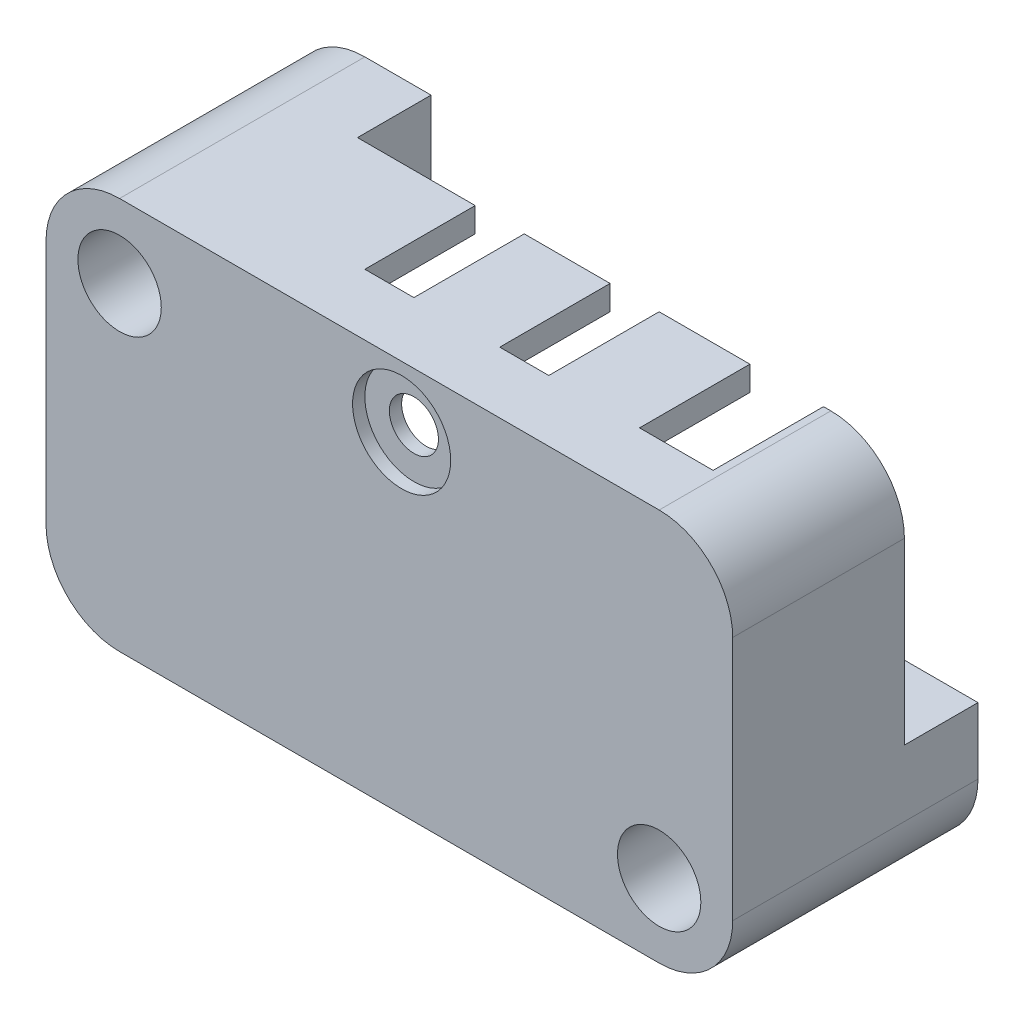
from build123d import *

# Parameters (mm, degrees)
SZKIC1_W                        = 28
SZKIC1_H                        = 16
DODANIE_WYCI_GNI_CIE1_DEPTH     = 10
WYTNIJ_WYCI_GNI_CIE1_REACH      = 20.974
SZKIC2_R                        = 1.7
ZAOKR_GLENIE1_R                 = 3
WYTNIJ_WYCI_GNI_CIE2_DEPTH      = 4
WYTNIJ_WYCI_GNI_CIE2_DEPTH_BACK = 4
WYTNIJ_WYCI_GNI_CIE3_DEPTH      = 3
WYTNIJ_WYCI_GNI_CIE4_REACH      = 25.495
SZKIC5_W                        = 2
SZKIC5_H                        = 4.5
SZKIC5_W_2                      = 3
SZKIC6_R                        = 2
WYTNIJ_WYCI_GNI_CIE5_DEPTH      = 0.5
WYTNIJ_WYCI_GNI_CIE6_REACH      = 20.715
SZKIC7_R                        = 1
WYTNIJ_WYCI_GNI_CIE7_REACH      = 32.79
SZKIC8_W                        = 5
SZKIC8_H                        = 1
WYTNIJ_WYCI_GNI_CIE8_REACH      = 25.495
SZKIC9_W                        = 1
SZKIC9_H                        = 5


with BuildPart() as part:
    # Szkic1 → Dodanie-wyciągnięcie1 (new body)
    with BuildSketch(Plane.XY):
        Rectangle(SZKIC1_W, SZKIC1_H)
    extrude(amount=DODANIE_WYCI_GNI_CIE1_DEPTH)

    # Szkic2 → Wytnij-wyciągnięcie1 (cut, up to next)
    with BuildSketch(Plane.XY.offset(10), mode=Mode.PRIVATE) as wytnij_wyci_gni_cie1_sk1:
        with Locations((-11, 5)):
            Circle(SZKIC2_R)
    wytnij_wyci_gni_cie1_tool1 = extrude(wytnij_wyci_gni_cie1_sk1.sketch, amount=-WYTNIJ_WYCI_GNI_CIE1_REACH, mode=Mode.PRIVATE) & part.part
    # Szkic2 → Wytnij-wyciągnięcie1 (cut, up to next)
    with BuildSketch(Plane.XY.offset(10), mode=Mode.PRIVATE) as wytnij_wyci_gni_cie1_sk2:
        with Locations((11, -5)):
            Circle(SZKIC2_R)
    wytnij_wyci_gni_cie1_tool2 = extrude(wytnij_wyci_gni_cie1_sk2.sketch, amount=-WYTNIJ_WYCI_GNI_CIE1_REACH, mode=Mode.PRIVATE) & part.part
    add(wytnij_wyci_gni_cie1_tool1.solids().sort_by_distance((-11, 5, 10))[0], mode=Mode.SUBTRACT)
    add(wytnij_wyci_gni_cie1_tool2.solids().sort_by_distance((11, -5, 10))[0], mode=Mode.SUBTRACT)

    # Zaokrąglenie1
    zaokr_glenie1_edges = [part.edges().sort_by_distance(p)[0] for p in [
        (-14, -8, 5),
        (14, -8, 5),
        (14, 8, 5),
        (-14, 8, 5),
    ]]
    fillet(zaokr_glenie1_edges, radius=ZAOKR_GLENIE1_R)

    # Szkic3 → Wytnij-wyciągnięcie2 (cut, two sides: drawn at the far end of the back side and taken through both)
    with BuildSketch(Plane.XY.offset(5).offset(-WYTNIJ_WYCI_GNI_CIE2_DEPTH_BACK)):
        with BuildLine():
            Line((11, 7), (-7.3, 7))
            ThreePointArc((-7.3, 7), (-8.007106781, 6.707106781), (-8.3, 6))
            Line((-8.3, 6), (-8.3, 5))
            ThreePointArc((-8.3, 5), (-9.090811691, 3.090811691), (-11, 2.3))
            Line((-11, 2.3), (-12, 2.3))
            ThreePointArc((-12, 2.3), (-12.707106781, 2.007106781), (-13, 1.3))
            Line((-13, 1.3), (-13, -5))
            ThreePointArc((-13, -5), (-12.414213562, -6.414213562), (-11, -7))
            Line((-11, -7), (7.3, -7))
            ThreePointArc((7.3, -7), (8.007106781, -6.707106781), (8.3, -6))
            Line((8.3, -6), (8.3, -5))
            ThreePointArc((8.3, -5), (9.090811691, -3.090811691), (11, -2.3))
            Line((11, -2.3), (12, -2.3))
            ThreePointArc((12, -2.3), (12.707106781, -2.007106781), (13, -1.3))
            Line((13, -1.3), (13, 5))
            ThreePointArc((13, 5), (12.414213562, 6.414213562), (11, 7))
        make_face()
    extrude(amount=WYTNIJ_WYCI_GNI_CIE2_DEPTH + WYTNIJ_WYCI_GNI_CIE2_DEPTH_BACK, mode=Mode.SUBTRACT)

    # Szkic4 → Wytnij-wyciągnięcie3 (cut)
    with BuildSketch(Plane(origin=(0, 0, 0), x_dir=(-1, 0, 0), z_dir=(0, 0, -1))):
        with BuildLine():
            Line((-11, 8), (8.3, 8))
            Line((8.3, 8), (8.3, 5))
            ThreePointArc((8.3, 5), (9.090811691, 3.090811691), (11, 2.3))
            Line((11, 2.3), (14, 2.3))
            Line((14, 2.3), (14, -5))
            ThreePointArc((14, -5), (13.121320344, -7.121320344), (11, -8))
            Line((11, -8), (-8.3, -8))
            Line((-8.3, -8), (-8.3, -5))
            ThreePointArc((-8.3, -5), (-9.090811691, -3.090811691), (-11, -2.3))
            Line((-11, -2.3), (-14, -2.3))
            Line((-14, -2.3), (-14, 5))
            ThreePointArc((-14, 5), (-13.121320344, 7.121320344), (-11, 8))
        make_face()
    extrude(amount=-WYTNIJ_WYCI_GNI_CIE3_DEPTH, mode=Mode.SUBTRACT)

    # Szkic5 → Wytnij-wyciągnięcie4 (cut, up to next)
    with BuildSketch(Plane(origin=(0, 8, 0), x_dir=(1, 0, 0), z_dir=(0, 1, 0)), mode=Mode.PRIVATE) as wytnij_wyci_gni_cie4_sk1:
        with Locations((3, -5.25)):
            Rectangle(SZKIC5_W, SZKIC5_H)
    wytnij_wyci_gni_cie4_tool1 = extrude(wytnij_wyci_gni_cie4_sk1.sketch, amount=-WYTNIJ_WYCI_GNI_CIE4_REACH, mode=Mode.PRIVATE) & part.part
    # Szkic5 → Wytnij-wyciągnięcie4 (cut, up to next)
    with BuildSketch(Plane(origin=(0, 8, 0), x_dir=(1, 0, 0), z_dir=(0, 1, 0)), mode=Mode.PRIVATE) as wytnij_wyci_gni_cie4_sk2:
        with Locations((9.2, -5.25)):
            Rectangle(SZKIC5_W_2, SZKIC5_H)
    wytnij_wyci_gni_cie4_tool2 = extrude(wytnij_wyci_gni_cie4_sk2.sketch, amount=-WYTNIJ_WYCI_GNI_CIE4_REACH, mode=Mode.PRIVATE) & part.part
    # Szkic5 → Wytnij-wyciągnięcie4 (cut, up to next)
    with BuildSketch(Plane(origin=(0, 8, 0), x_dir=(1, 0, 0), z_dir=(0, 1, 0)), mode=Mode.PRIVATE) as wytnij_wyci_gni_cie4_sk3:
        with Locations((-2.5, -5.25)):
            Rectangle(SZKIC5_W, SZKIC5_H)
    wytnij_wyci_gni_cie4_tool3 = extrude(wytnij_wyci_gni_cie4_sk3.sketch, amount=-WYTNIJ_WYCI_GNI_CIE4_REACH, mode=Mode.PRIVATE) & part.part
    add(wytnij_wyci_gni_cie4_tool1.solids().sort_by_distance((3, 8, 5.25))[0], mode=Mode.SUBTRACT)
    add(wytnij_wyci_gni_cie4_tool2.solids().sort_by_distance((9.2, 8, 5.25))[0], mode=Mode.SUBTRACT)
    add(wytnij_wyci_gni_cie4_tool3.solids().sort_by_distance((-2.5, 8, 5.25))[0], mode=Mode.SUBTRACT)

    # Szkic6 → Wytnij-wyciągnięcie5 (cut)
    with BuildSketch(Plane.XY.offset(10)):
        with Locations((0.5, 5.5)):
            Circle(SZKIC6_R)
    extrude(amount=-WYTNIJ_WYCI_GNI_CIE5_DEPTH, mode=Mode.SUBTRACT)

    # Szkic7 → Wytnij-wyciągnięcie6 (cut, up to next)
    with BuildSketch(Plane.XY.offset(9.5), mode=Mode.PRIVATE) as wytnij_wyci_gni_cie6_sk1:
        with Locations((0.5, 5.5)):
            Circle(SZKIC7_R)
    wytnij_wyci_gni_cie6_tool1 = extrude(wytnij_wyci_gni_cie6_sk1.sketch, amount=-WYTNIJ_WYCI_GNI_CIE6_REACH, mode=Mode.PRIVATE) & part.part
    add(wytnij_wyci_gni_cie6_tool1.solids().sort_by_distance((0.5, 5.5, 9.5))[0], mode=Mode.SUBTRACT)

    # Szkic8 → Wytnij-wyciągnięcie7 (cut, up to next)
    with BuildSketch(Plane.ZY.offset(14), mode=Mode.PRIVATE) as wytnij_wyci_gni_cie7_sk1:
        with Locations((5.5, 1.6)):
            Rectangle(SZKIC8_W, SZKIC8_H)
    wytnij_wyci_gni_cie7_tool1 = extrude(wytnij_wyci_gni_cie7_sk1.sketch, amount=-WYTNIJ_WYCI_GNI_CIE7_REACH, mode=Mode.PRIVATE) & part.part
    # Szkic8 → Wytnij-wyciągnięcie7 (cut, up to next)
    with BuildSketch(Plane.ZY.offset(14), mode=Mode.PRIVATE) as wytnij_wyci_gni_cie7_sk2:
        with Locations((5.5, -3.8)):
            Rectangle(SZKIC8_W, SZKIC8_H)
    wytnij_wyci_gni_cie7_tool2 = extrude(wytnij_wyci_gni_cie7_sk2.sketch, amount=-WYTNIJ_WYCI_GNI_CIE7_REACH, mode=Mode.PRIVATE) & part.part
    add(wytnij_wyci_gni_cie7_tool1.solids().sort_by_distance((-14, 1.6, 5.5))[0], mode=Mode.SUBTRACT)
    add(wytnij_wyci_gni_cie7_tool2.solids().sort_by_distance((-14, -3.8, 5.5))[0], mode=Mode.SUBTRACT)

    # Szkic9 → Wytnij-wyciągnięcie8 (cut, up to next)
    with BuildSketch(Plane.XZ.offset(8), mode=Mode.PRIVATE) as wytnij_wyci_gni_cie8_sk1:
        with Locations((-2, 5.5)):
            Rectangle(SZKIC9_W, SZKIC9_H)
    wytnij_wyci_gni_cie8_tool1 = extrude(wytnij_wyci_gni_cie8_sk1.sketch, amount=-WYTNIJ_WYCI_GNI_CIE8_REACH, mode=Mode.PRIVATE) & part.part
    add(wytnij_wyci_gni_cie8_tool1.solids().sort_by_distance((-2, -8, 5.5))[0], mode=Mode.SUBTRACT)


solid = part.part
